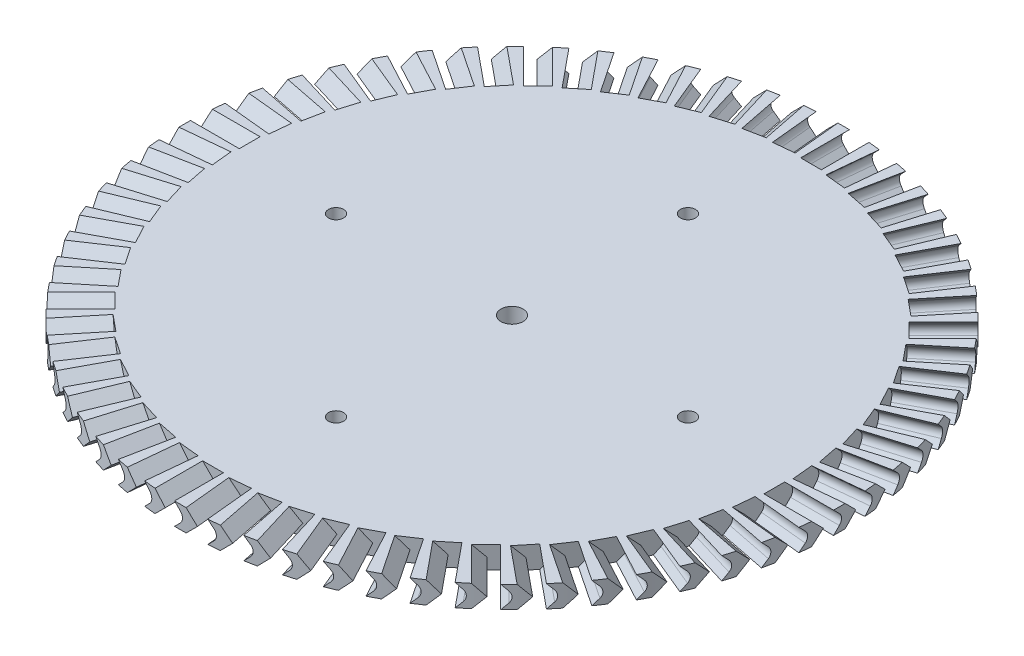
from build123d import *

# Parameters (mm, degrees)
SKETCH1_R           = 142.6972
SKETCH1_R_2         = 4.7625
BOSS_EXTRUDE1_DEPTH = 9.525
CUT_EXTRUDE1_DEPTH  = 21.1582
CIRPATTERN1_COUNT   = 64
CIRPATTERN2_COUNT   = 4


with BuildPart() as part:
    # Sketch1 → Boss-Extrude1 (new body)
    with BuildSketch(Plane(origin=(0, 0, 0), x_dir=(1, 0, 0), z_dir=(0, 1, 0))):
        Circle(SKETCH1_R)
        Circle(SKETCH1_R_2, mode=Mode.SUBTRACT)
    extrude(amount=BOSS_EXTRUDE1_DEPTH)

    # Sketch2 → Cut-Extrude1 (cut)
    with BuildSketch(Plane.XY.offset(142.6972)):
        with BuildLine():
            Line((-3.447371939, 0), (-0.92993597, 2.51743597))
            ThreePointArc((-0.92993597, 2.51743597), (0, 4.7625), (-0.92993597, 7.00756403))
            Line((-0.92993597, 7.00756403), (-3.447371939, 9.525))
            Line((-3.447371939, 9.525), (-12.427628061, 9.525))
            Line((-12.427628061, 9.525), (-7.665128061, 4.7625))
            Line((-7.665128061, 4.7625), (-12.427628061, 0))
            Line((-12.427628061, 0), (-3.447371939, 0))
        make_face()
    cut_extrude1 = extrude(amount=-CUT_EXTRUDE1_DEPTH, mode=Mode.SUBTRACT)

    # CirPattern1: Cut-Extrude1 ×64 about axis
    cirpattern1_axis = Axis((0, 9.525, 0), (0, -1, 0))
    for i in range(1, CIRPATTERN1_COUNT):
        add(cut_extrude1.rotate(cirpattern1_axis, i * 360 / CIRPATTERN1_COUNT), mode=Mode.SUBTRACT)

    # Sketch3 → CBORE for 1/4 Binding Head Machine Screw1 (revolve, cut)
    with BuildSketch(Plane(origin=(0, 0, 76.2), x_dir=(0, 0, -1), z_dir=(1, 0, 0))):
        Polygon((0, 0), (0, 14.661148974), (3.2639, 12.7), (3.2639, 4.191), (7.14375, 4.191), (7.14375, 0), align=None)
    cbore_for_1_4_binding_head_machine_screw = revolve(axis=Axis((0, -6.35, 76.2), (0, 1, 0)), mode=Mode.SUBTRACT)

    # CirPattern2: CBORE for 1/4 Binding Head Machine Screw1 ×4 about axis
    cirpattern2_axis = Axis((0, 9.525, 0), (0, -1, 0))
    for i in range(1, CIRPATTERN2_COUNT):
        add(cbore_for_1_4_binding_head_machine_screw.rotate(cirpattern2_axis, i * 360 / CIRPATTERN2_COUNT), mode=Mode.SUBTRACT)


solid = part.part
